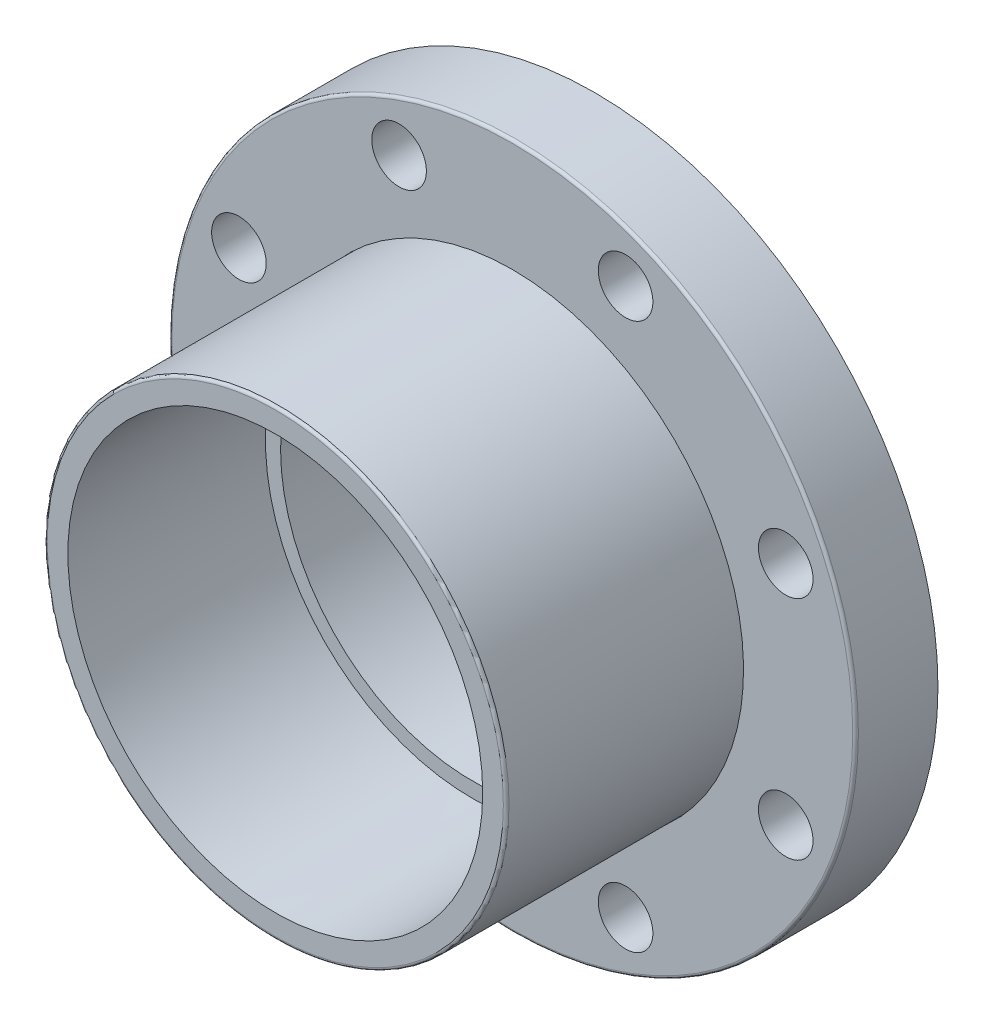
from build123d import *

# Parameters (mm, degrees)
SKETCH1_R                       = 139.7
EXTRUDE1_DEPTH                  = 33.528
SKETCH2_R                       = 93.98
EXTRUDE2_DEPTH                  = 96.472
SKETCH3_R                       = 11.1125
EXTRUDE3_DEPTH                  = 220.861380838
CIRPATTERN1_COUNT               = 8
FILLET1_R                       = 1.154545455
CUT_REVOLVE_THIN1_START         = 16.059727273
CUT_REVOLVE_THIN1_OUTLINE_R     = 94.107
CUT_REVOLVE_THIN1_OUTLINE_R_2   = 93.98
CUT_REVOLVE_THIN1_DEPTH         = 17.468272727
CUT_REVOLVE_THIN1_2_OUTLINE_R   = 82.972009834
CUT_REVOLVE_THIN1_2_OUTLINE_R_2 = 82.845009834
CUT_REVOLVE_THIN1_2_DEPTH       = 16.186727273
CUT_REVOLVE_THIN1_3_OUTLINE_R   = 93.98
CUT_REVOLVE_THIN1_3_OUTLINE_R_2 = 82.972009834
CUT_REVOLVE_THIN1_3_DEPTH       = 0.127


# Read off the part's stored shape, not the designer's step: Cut-Revolve-Thin1
with BuildPart() as part:
    # Sketch1 → Extrude1 (new body)
    with BuildSketch(Plane.XY):
        Circle(SKETCH1_R)
    extrude(amount=EXTRUDE1_DEPTH)

    # Sketch2 → Extrude2 (add)
    with BuildSketch(Plane.XY.offset(33.528)):
        with Locations(Location((0, 0, 0), (0, 0, 180))):
            Circle(SKETCH2_R)
    extrude(amount=EXTRUDE2_DEPTH)

    # Sketch3 → Extrude3 (cut, through all)
    with BuildSketch(Plane.XY.offset(33.528)):
        with Locations((-46.090580656, 111.272504917)):
            Circle(SKETCH3_R)
    extrude3 = extrude(amount=-EXTRUDE3_DEPTH, mode=Mode.SUBTRACT)

    # CirPattern1: Extrude3 ×8 about axis
    cirpattern1_axis = Axis((0, 0, 0), (0, 0, 1))
    for i in range(1, CIRPATTERN1_COUNT):
        add(extrude3.rotate(cirpattern1_axis, i * 360 / CIRPATTERN1_COUNT), mode=Mode.SUBTRACT)

    # Fillet1
    fillet1_edges = [part.edges().sort_by_distance(p)[0] for p in [
        (-139.7, 0, 33.528),
        (93.98, 0, 130),
    ]]
    fillet(fillet1_edges, radius=FILLET1_R)

    # Sketch4 → Cut-Revolve1 (revolve, cut)
    with BuildSketch(Plane(origin=(0, 0, 62.70625), x_dir=(0, 0, 1), z_dir=(-1, 0, 0)), mode=Mode.PRIVATE) as cut_revolve1_sk:
        Polygon((-62.70625, 77.851), (-12.70625, 77.851), (-12.70625, 83.9978), (67.29375, 84.4169), (67.29375, 0), (-62.70625, 0), align=None)
    revolve(cut_revolve1_sk.sketch.rotate(Axis((0, 0, 130), (0, 0, -1)), 90), axis=Axis((0, 0, 130), (0, 0, -1)), mode=Mode.SUBTRACT)

    # Cut-Revolve-Thin1 outline → Cut-Revolve-Thin1 (cut)
    with BuildSketch(Plane.XY.offset(CUT_REVOLVE_THIN1_START)):
        Circle(CUT_REVOLVE_THIN1_OUTLINE_R)
        Circle(CUT_REVOLVE_THIN1_OUTLINE_R_2, mode=Mode.SUBTRACT)
    extrude(amount=CUT_REVOLVE_THIN1_DEPTH, mode=Mode.SUBTRACT)

    # Cut-Revolve-Thin1 2 outline → Cut-Revolve-Thin1 2 (cut)
    with BuildSketch(Plane.XY):
        Circle(CUT_REVOLVE_THIN1_2_OUTLINE_R)
        Circle(CUT_REVOLVE_THIN1_2_OUTLINE_R_2, mode=Mode.SUBTRACT)
    extrude(amount=CUT_REVOLVE_THIN1_2_DEPTH, mode=Mode.SUBTRACT)

    # Cut-Revolve-Thin1 3 outline → Cut-Revolve-Thin1 3 (cut)
    with BuildSketch(Plane.XY.offset(CUT_REVOLVE_THIN1_START)):
        Circle(CUT_REVOLVE_THIN1_3_OUTLINE_R)
        Circle(CUT_REVOLVE_THIN1_3_OUTLINE_R_2, mode=Mode.SUBTRACT)
    extrude(amount=CUT_REVOLVE_THIN1_3_DEPTH, mode=Mode.SUBTRACT)


solid = part.part
